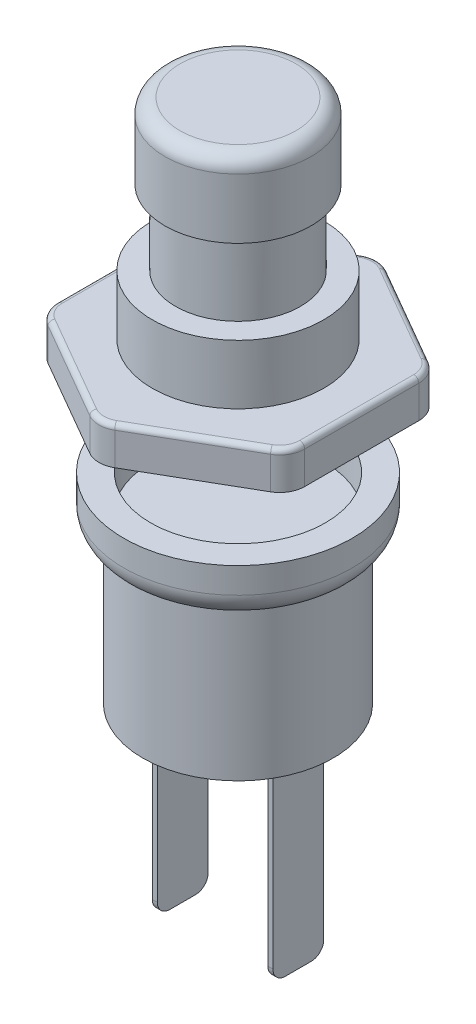
from build123d import *

# Parameters (mm, degrees)
SKETCH3_R              = 2.921
BOSS_EXTRUDE1_DEPTH    = 3
FILLET3_R              = 0.6
FILLET1_R              = 1
SKETCH4_W              = 0.2
SKETCH4_H              = 2.032
BOSS_EXTRUDE2_DEPTH    = 8
FILLET2_R              = 0.5
BOSS_EXTRUDE3_DEPTH    = 1.5
FILLET4_R              = 1
FILLET5_R              = 0.2
CUT_EXTRUDE4_START     = -4.549597879
CUT_EXTRUDE4_OUTLINE_R = 3.5
CUT_EXTRUDE4_DEPTH     = 4.549597879


with BuildPart() as part:
    # Sketch2 → Revolve1 (revolve)
    with BuildSketch(Plane.XY, mode=Mode.PRIVATE) as revolve1_sk:
        Polygon((0, 0), (3.81, 0), (3.81, 6), (4.572, 6), (4.572, 8), (3.43, 8), (3.43, 15), (2.5, 15), (2.5, 18), (0, 18), align=None)
    revolve(revolve1_sk.sketch.rotate(Axis((0, 0, 0), (0, 1, 0)), 90), axis=Axis((0, 0, 0), (0, 1, 0)))

    # Sketch3 → Boss-Extrude1 (add)
    with BuildSketch(Plane(origin=(0, 18, 0), x_dir=(1, 0, 0), z_dir=(0, 1, 0))):
        with Locations(Location((0, 0, 0), (0, 0, 270))):
            Circle(SKETCH3_R)
    extrude(amount=BOSS_EXTRUDE1_DEPTH)

    # Fillet3
    fillet3_edges = [part.edges().sort_by_distance(p)[0] for p in [
        (0, 21, -2.921),
    ]]
    fillet(fillet3_edges, radius=FILLET3_R)

    # Fillet1
    # the kernel refuses this fillet: 1 mm, written as the material it takes off along each edge
    with BuildSketch(Plane(origin=(0, 6, 0), x_dir=(0, 0, -1), z_dir=(1, 0, 0))) as fillet1_piece_1:
        with BuildLine():
            CenterArc((3.572, 0.971265154), FILLET1_R, 283.768528752, 76.231471248)
            Line((3.81, 0), (3.81476, -0.019425303))
            ThreePointArc((3.81476, -0.019425303), (4.191, -0.02), (4.572, -0.02))
            Line((4.572, -0.02), (4.592, 0))
            Line((4.592, 0), (4.592, 0.971265154))
            Line((4.592, 0.971265154), (4.572, 0.971265154))
        make_face()
    revolve(axis=Axis((0, 6, 0), (0, 1, 0)), mode=Mode.SUBTRACT)

    # Sketch4 → Boss-Extrude2 (add)
    with BuildSketch(Plane.XZ):
        with Locations((-2.313, 0)):
            Rectangle(SKETCH4_W, SKETCH4_H)
        with Locations((2.313, 0)):
            Rectangle(SKETCH4_W, SKETCH4_H)
    extrude(amount=BOSS_EXTRUDE2_DEPTH)

    # Fillet2
    fillet2_edges = [part.edges().sort_by_distance(p)[0] for p in [
        (-2.313, -8, -1.016),
        (-2.313, -8, 1.016),
        (2.313, -8, 1.016),
        (2.313, -8, -1.016),
    ]]
    fillet(fillet2_edges, radius=FILLET2_R)

    # Sketch5 → Boss-Extrude3 (add)
    with BuildSketch(Plane(origin=(0, 11.125, 0), x_dir=(1, 0, 0), z_dir=(0, 1, 0))):
        Polygon((-4.953, -2.859615883), (0, -5.719231767), (4.953, -2.859615883), (4.953, 2.859615883), (0, 5.719231767), (-4.953, 2.859615883), align=None)
    extrude(amount=BOSS_EXTRUDE3_DEPTH)

    # Fillet4
    fillet4_edges = [part.edges().sort_by_distance(p)[0] for p in [
        (-4.953, 11.875, -2.859615883),
        (-4.953, 11.875, 2.859615883),
        (0, 11.875, 5.719231767),
        (4.953, 11.875, 2.859615883),
        (4.953, 11.875, -2.859615883),
        (0, 11.875, -5.719231767),
    ]]
    fillet(fillet4_edges, radius=FILLET4_R)

    # Fillet5
    fillet5_edges = [part.edges().sort_by_distance(p)[0] for p in [
        (2.4765, 12.625, -4.289423825),
        (4.953, 12.625, 0),
        (-4.953, 12.625, 0),
        (-2.4765, 12.625, 4.289423825),
        (2.4765, 12.625, 4.289423825),
        (-2.4765, 12.625, -4.289423825),
        (0, 12.625, -5.564531228),
        (-4.819025404, 12.625, -2.782265614),
        (-4.819025404, 12.625, 2.782265614),
        (0, 12.625, 5.564531228),
        (4.819025404, 12.625, 2.782265614),
        (4.819025404, 12.625, -2.782265614),
    ]]
    fillet(fillet5_edges, radius=FILLET5_R)

    # Cut-Extrude4: read off the stored shape, not the designer's step
    # Cut-Extrude4 outline → Cut-Extrude4 (cut)
    with BuildSketch(Plane(origin=(164.73864921, 11.125, 74.332771541), x_dir=(-0.11726284884639014, 0, 0.9931009134425507), z_dir=(0, 1, 0)).offset(CUT_EXTRUDE4_START)):
        with Locations((-54.502219995, -172.318575564)):
            Circle(CUT_EXTRUDE4_OUTLINE_R)
    extrude(amount=CUT_EXTRUDE4_DEPTH, mode=Mode.SUBTRACT)


solid = part.part
